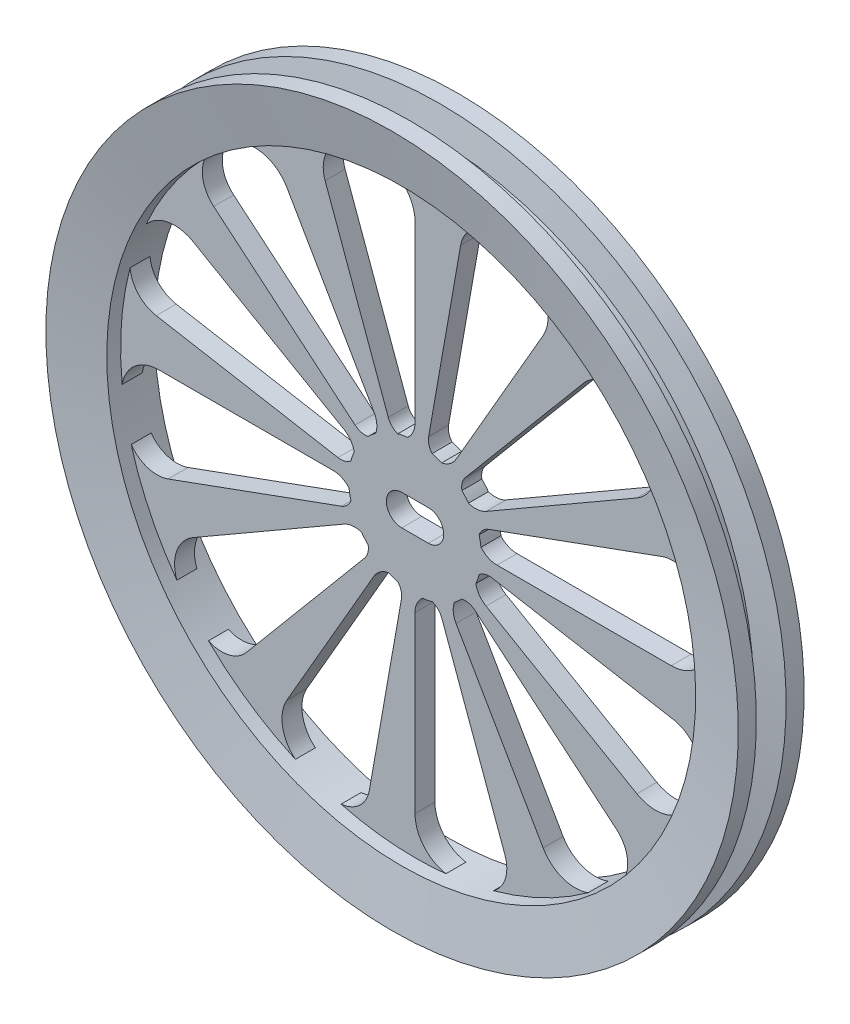
from build123d import *

# Parameters (mm, degrees)
CUT_EXTRUDE3_START = -2.387057914
CUT_EXTRUDE3_DEPTH = 2.387057914
CIRPATTERN2_COUNT  = 12
CUT_EXTRUDE4_DEPTH = 59.793512223


# Read off the part's stored shape, not the designer's step: Cut-Extrude3
with BuildPart() as part:
    # Sketch1 → Revolve1 (revolve)
    with BuildSketch(Plane(origin=(0, 0, 0), x_dir=(0, 0, -1), z_dir=(1, 0, 0)), mode=Mode.PRIVATE) as revolve1_sk:
        Polygon((-1.193528957, 0), (-1.193528957, 35.218988836), (-2.844528957, 35.218988836), (-3.937, 41.4147), (-1.778, 41.4147), (-1.193528957, 38.1), (1.193528957, 38.1), (1.778, 41.4147), (3.937, 41.4147), (2.844528957, 35.218988836), (1.193528957, 35.218988836), (1.193528957, 0), align=None)
    revolve(revolve1_sk.sketch.rotate(Axis((0, 0, 1.193528957), (0, 0, -1)), 180), axis=Axis((0, 0, 1.193528957), (0, 0, -1)))

    # Cut-Extrude3 outline → Cut-Extrude3 (cut)
    with BuildSketch(Plane(origin=(0, 0, -1.193528957), x_dir=(-1, 0, 0), z_dir=(0, 0, -1)).offset(CUT_EXTRUDE3_START)):
        with BuildLine():
            ThreePointArc((2.066345579, 7.663819035), (2.76104062, 8.106910335), (3.203637142, 8.801920708))
            Line((3.203637142, 8.801920708), (10.751653826, 29.539926109))
            ThreePointArc((10.751653826, 29.539926109), (10.809621103, 31.974229594), (9.381543944, 33.946484469))
            ThreePointArc((9.381543944, 33.946484469), (6.561048987, 34.602453827), (3.696198494, 35.02449559))
            ThreePointArc((3.696198494, 35.02449559), (1.047467977, 33.509168244), (0, 30.643020803))
            Line((0, 30.643020803), (0, 9.811006208))
            ThreePointArc((0, 9.811006208), (0.230432564, 8.753888306), (0.879919889, 7.88857701))
            ThreePointArc((0.879919889, 7.88857701), (1.477412972, 7.798792032), (2.066345579, 7.663819035))
        make_face()
    cut_extrude3 = extrude(amount=CUT_EXTRUDE3_DEPTH, mode=Mode.SUBTRACT)

    # CirPattern2: Cut-Extrude3 ×12 about axis
    cirpattern2_axis = Axis((0, 0, 0), (0, 0, 1))
    for i in range(1, CIRPATTERN2_COUNT):
        add(cut_extrude3.rotate(cirpattern2_axis, i * 360 / CIRPATTERN2_COUNT), mode=Mode.SUBTRACT)

    # Sketch2 → Cut-Extrude4 (cut, through all)
    with BuildSketch(Plane(origin=(0, 0, -1.193528957), x_dir=(-1, 0, 0), z_dir=(0, 0, -1))):
        with BuildLine():
            Line((-1.5875, 1.8415), (1.5875, 1.8415))
            ThreePointArc((1.5875, 1.8415), (3.429, 0), (1.5875, -1.8415))
            Line((1.5875, -1.8415), (-1.5875, -1.8415))
            ThreePointArc((-1.5875, -1.8415), (-3.429, 0), (-1.5875, 1.8415))
        make_face()
    extrude(amount=-CUT_EXTRUDE4_DEPTH, mode=Mode.SUBTRACT)


solid = part.part
